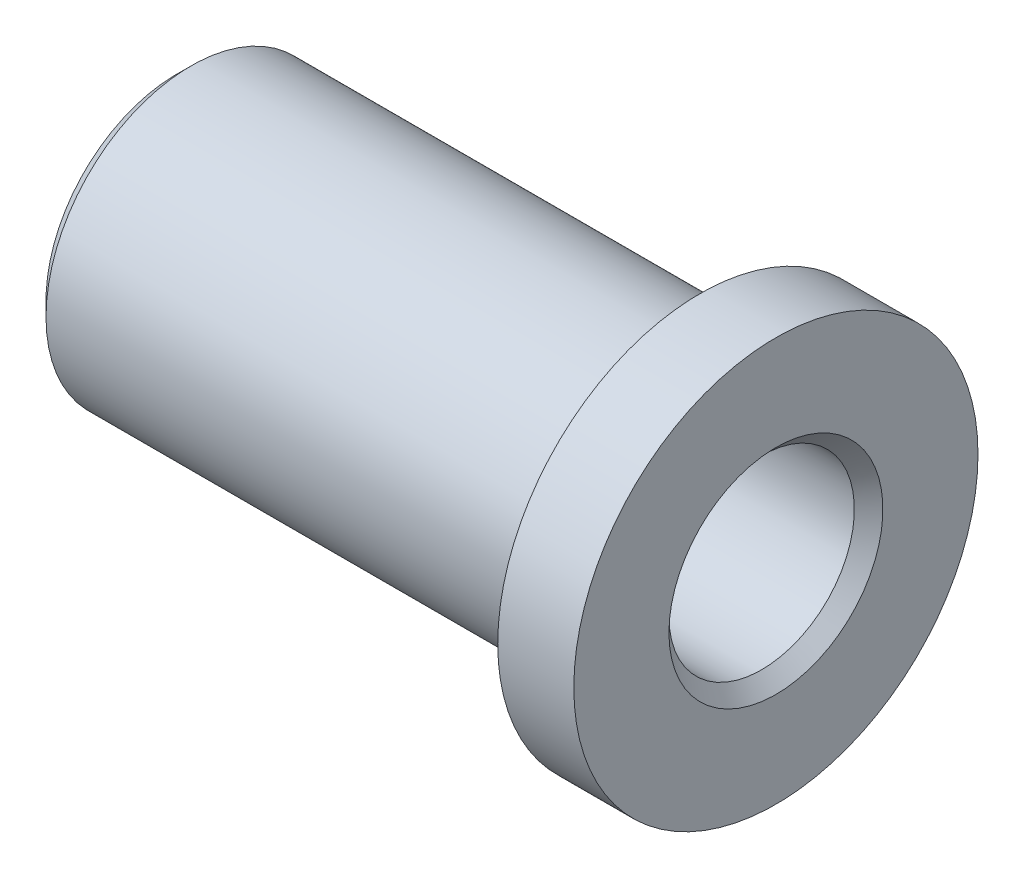
from build123d import *

# Parameters (mm, degrees)
SMUSSO1_SIZE = 0.6


with BuildPart() as part:
    # Schizzo1 → Rivoluzione1 (revolve)
    with BuildSketch(Plane(origin=(0, 0, 0), x_dir=(1, 0, 0), z_dir=(0, 1, 0))):
        with BuildLine():
            Line((0, 3.9), (0, 6.1))
            Line((0, 6.1), (21.8, 6.1))
            ThreePointArc((21.8, 6.1), (21.941421356, 6.158578644), (22, 6.3))
            Line((22, 6.3), (22, 8.5))
            Line((22, 8.5), (25.2, 8.5))
            Line((25.2, 8.5), (25.2, 3.9))
            Line((25.2, 3.9), (0, 3.9))
        make_face()
    revolve(axis=Axis((-60.499740909, 0, 0), (1, 0, 0)))

    # Smusso1
    smusso1_edges = [part.edges().sort_by_distance(p)[0] for p in [
        (0, 0, 6.1),
        (0, 0, 3.9),
        (25.2, 0, 3.9),
    ]]
    chamfer(smusso1_edges, length=SMUSSO1_SIZE)


solid = part.part
